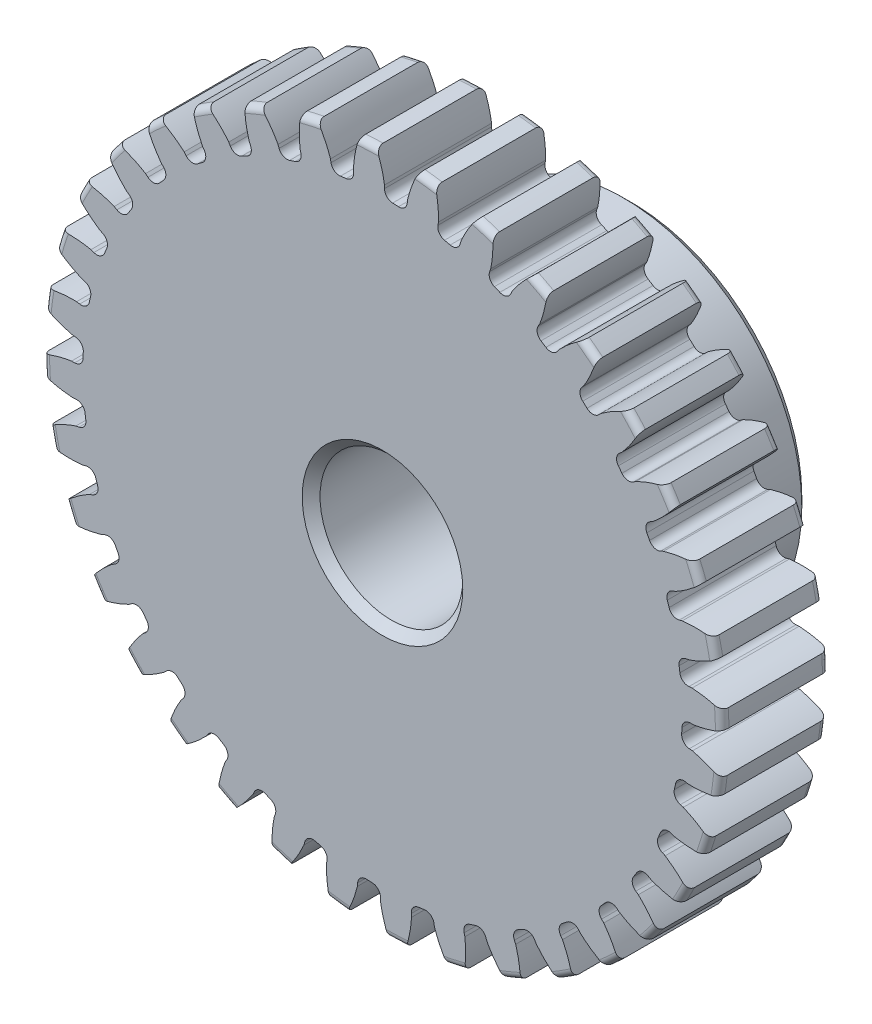
from build123d import *

# Parameters (mm, degrees)
SKETCH1_R                = 15.113
BOSS_EXTRUDE1_DEPTH      = 4.7625
SKETCH2_W                = 6.35
SKETCH2_H                = 7.9375
FILLET2_R                = 0.30226
CUT_EXTRUDE1_DEPTH       = 25.089275566
FILLET1_R                = 0.37404675
CIRPATTERN1_COUNT        = 36
FILLET1_OF_CIRPATTERN1_R = 0.37404675
SKETCH5_R                = 3.175
CUT_EXTRUDE2_DEPTH       = 25.086098855
CHAMFER1_SIZE            = 0.396875


with BuildPart() as part:
    # Sketch1 → Boss-Extrude1 (new body)
    with BuildSketch(Plane.XY):
        Circle(SKETCH1_R)
    extrude(amount=-BOSS_EXTRUDE1_DEPTH)

    # Sketch2 → Revolve1 (revolve)
    with BuildSketch(Plane(origin=(0, 0, 0), x_dir=(0, 0, -1), z_dir=(1, 0, 0))):
        with Locations((7.9375, 3.96875)):
            Rectangle(SKETCH2_W, SKETCH2_H)
    revolve(axis=Axis((0, 0, -4.7625), (0, 0, -1)))

    # Fillet2
    fillet2_edges = [part.edges().sort_by_distance(p)[0] for p in [
        (-15.113, 0, -4.7625),
        (-15.113, 0, 0),
        (0, -7.9375, -4.7625),
    ]]
    fillet(fillet2_edges, radius=FILLET2_R)

    # Sketch4 → Cut-Extrude1 (cut, through all)
    with BuildSketch(Plane.XY):
        with BuildLine():
            Line((0.089839372, 13.832117662), (0.089839372, 13.326759687))
            ThreePointArc((0.089839372, 13.326759687), (0.58131966, 13.31437803), (1.072008843, 13.283877142))
            Line((1.072008843, 13.283877142), (1.116053796, 13.787312068))
            add(Edge.make_bspline(
                [(2.879412409, 16.608594762), (1.511094277, 15.415219527), (1.116053796, 13.787312068)],
                knots=[0, 0, 0, 1, 1, 1], degree=2))
            ThreePointArc((2.879412409, 16.608594762), (0.73526525, 16.840303465), (-1.420917535, 16.796351662))
            add(Edge.make_bspline(
                [(-1.420917535, 16.796351662), (-0.161816039, 15.48826054), (0.089839372, 13.832117662)],
                knots=[0, 0, 0, 1, 1, 1], degree=2))
        make_face()
    cut_extrude1 = extrude(amount=-CUT_EXTRUDE1_DEPTH, mode=Mode.SUBTRACT)

    # Fillet1
    fillet1_edges = [part.edges().sort_by_distance(p)[0] for p in [
        (1.072008843, 13.283877142, -2.38125),
        (0.089839372, 13.326759687, -2.38125),
    ]]
    fillet(fillet1_edges, radius=FILLET1_R)

    # CirPattern1: Cut-Extrude1 ×36 about axis
    cirpattern1_axis = Axis((0, 0, -4.7625), (0, 0, 1))
    for i in range(1, CIRPATTERN1_COUNT):
        add(cut_extrude1.rotate(cirpattern1_axis, i * 360 / CIRPATTERN1_COUNT), mode=Mode.SUBTRACT)

    # Fillet1 of CirPattern1
    fillet1_of_cirpattern1_edges = [part.edges().sort_by_distance(p)[0] for p in [
        (-1.250998438, 13.268217581, -2.38125),
        (-2.225693024, 13.139896706, -2.38125),
        (-3.535994764, 12.849409944, -2.38125),
        (-4.473598863, 12.553784612, -2.38125),
        (-5.713551679, 12.040179487, -2.38125),
        (-6.585576665, 11.586232126, -2.38125),
        (-7.717505218, 10.86511427, -2.38125),
        (-8.497455052, 10.266637839, -2.38125),
        (-9.486966266, 9.359918053, -2.38125),
        (-10.151142568, 8.635096956, -2.38125),
        (-10.968170644, 7.570325462, -2.38125),
        (-11.496392753, 6.741183022, -2.38125),
        (-12.116112707, 5.550712364, -2.38125),
        (-12.492330862, 4.642441654, -2.38125),
        (-12.895912817, 3.362443678, -2.38125),
        (-13.108695819, 2.402642044, -2.38125),
        (-13.283877142, 1.072008843, -2.38125),
        (-13.326759687, 0.089839372, -2.38125),
        (-13.268217581, -1.250998438, -2.38125),
        (-13.139896706, -2.225693024, -2.38125),
        (-12.849409944, -3.535994764, -2.38125),
        (-12.553784612, -4.473598863, -2.38125),
        (-12.040179487, -5.713551679, -2.38125),
        (-11.586232126, -6.585576665, -2.38125),
        (-10.86511427, -7.717505218, -2.38125),
        (-10.266637839, -8.497455052, -2.38125),
        (-9.359918053, -9.486966266, -2.38125),
        (-8.635096956, -10.151142568, -2.38125),
        (-7.570325462, -10.968170644, -2.38125),
        (-6.741183022, -11.496392753, -2.38125),
        (-5.550712364, -12.116112707, -2.38125),
        (-4.642441654, -12.492330862, -2.38125),
        (-3.362443678, -12.895912817, -2.38125),
        (-2.402642044, -13.108695819, -2.38125),
        (-1.072008843, -13.283877142, -2.38125),
        (-0.089839372, -13.326759687, -2.38125),
        (1.250998438, -13.268217581, -2.38125),
        (2.225693024, -13.139896706, -2.38125),
        (3.535994764, -12.849409944, -2.38125),
        (4.473598863, -12.553784612, -2.38125),
        (5.713551679, -12.040179487, -2.38125),
        (6.585576665, -11.586232126, -2.38125),
        (7.717505218, -10.86511427, -2.38125),
        (8.497455052, -10.266637839, -2.38125),
        (9.486966266, -9.359918053, -2.38125),
        (10.151142568, -8.635096956, -2.38125),
        (10.968170644, -7.570325462, -2.38125),
        (11.496392753, -6.741183022, -2.38125),
        (12.116112707, -5.550712364, -2.38125),
        (12.492330862, -4.642441654, -2.38125),
        (12.895912817, -3.362443678, -2.38125),
        (13.108695819, -2.402642044, -2.38125),
        (13.283877142, -1.072008843, -2.38125),
        (13.326759687, -0.089839372, -2.38125),
        (13.268217581, 1.250998438, -2.38125),
        (13.139896706, 2.225693024, -2.38125),
        (12.849409944, 3.535994764, -2.38125),
        (12.553784612, 4.473598863, -2.38125),
        (12.040179487, 5.713551679, -2.38125),
        (11.586232126, 6.585576665, -2.38125),
        (10.86511427, 7.717505218, -2.38125),
        (10.266637839, 8.497455052, -2.38125),
        (9.359918053, 9.486966266, -2.38125),
        (8.635096956, 10.151142568, -2.38125),
        (7.570325462, 10.968170644, -2.38125),
        (6.741183022, 11.496392753, -2.38125),
        (5.550712364, 12.116112707, -2.38125),
        (4.642441654, 12.492330862, -2.38125),
        (3.362443678, 12.895912817, -2.38125),
        (2.402642044, 13.108695819, -2.38125),
    ]]
    fillet(fillet1_of_cirpattern1_edges, radius=FILLET1_OF_CIRPATTERN1_R)

    # Sketch5 → Cut-Extrude2 (cut, through all)
    with BuildSketch(Plane.XY):
        Circle(SKETCH5_R)
    extrude(amount=-CUT_EXTRUDE2_DEPTH, mode=Mode.SUBTRACT)

    # Chamfer1
    chamfer1_edges = [part.edges().sort_by_distance(p)[0] for p in [
        (0, -7.9375, -11.1125),
        (-3.175, 0, 0),
        (-3.175, 0, -11.1125),
    ]]
    chamfer(chamfer1_edges, length=CHAMFER1_SIZE)


solid = part.part
